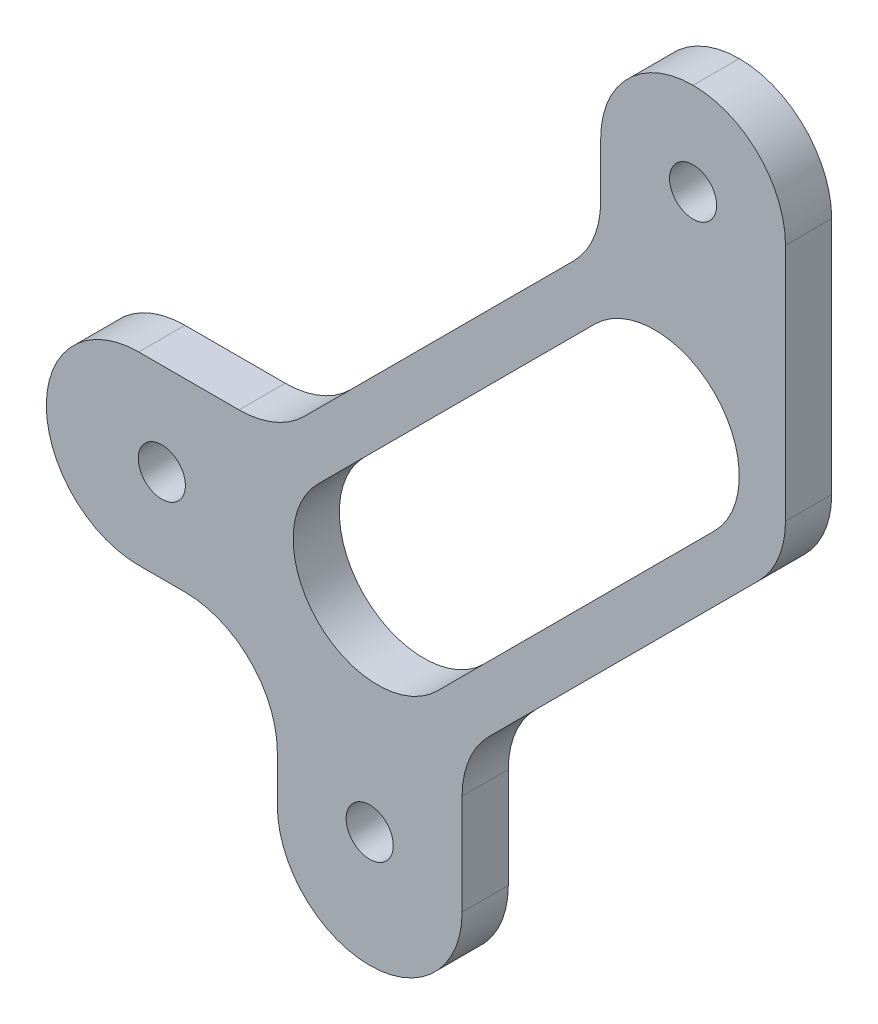
from build123d import *

# Parameters (mm, degrees)
SKETCH_1_R          = 2.55
EXTRUDE_1_DEPTH     = 5
FILLET_1_R          = 10
CUT_EXTRUDE_1_DEPTH = 94.139680051


with BuildPart() as part:
    # ｽｹｯﾁ1 → ﾎﾞｽ - 押し出し1 (new body)
    with BuildSketch(Plane.XY):
        Polygon((0, -25), (0, 0), (-25, 0), (-25, 20), (0, 20), (35, 55), (35, 75), (55, 75), (55, 35), (20, 0), (20, -25), align=None)
        with Locations((-12.5, 10)):
            Circle(SKETCH_1_R, mode=Mode.SUBTRACT)
        with Locations((10, -12.5)):
            Circle(SKETCH_1_R, mode=Mode.SUBTRACT)
        with Locations((45, 65)):
            Circle(SKETCH_1_R, mode=Mode.SUBTRACT)
    extrude(amount=EXTRUDE_1_DEPTH)

    # ﾌｨﾚｯﾄ1
    fillet_1_edges = [part.edges().sort_by_distance(p)[0] for p in [
        (35, 75, 2.5),
        (55, 75, 2.5),
        (20, 0, 2.5),
        (20, -25, 2.5),
        (0, -25, 2.5),
        (0, 0, 2.5),
        (-25, 0, 2.5),
        (-25, 20, 2.5),
        (0, 20, 2.5),
        (35, 55, 2.5),
        (55, 35, 2.5),
    ]]
    fillet(fillet_1_edges, radius=FILLET_1_R - 0.0001)  # a hair under: the kernel refuses the full size

    # ｽｹｯﾁ2 → ｶｯﾄ - 押し出し1 (cut, through all)
    with BuildSketch(Plane.XY.offset(5)):
        with BuildLine():
            Line((4.393398282, 17.32233047), (34.393398282, 47.32233047))
            ThreePointArc((34.393398282, 47.32233047), (47.32233047, 47.32233047), (47.32233047, 34.393398282))
            Line((47.32233047, 34.393398282), (17.32233047, 4.393398282))
            ThreePointArc((17.32233047, 4.393398282), (4.393398282, 4.393398282), (4.393398282, 17.32233047))
        make_face()
    extrude(amount=-CUT_EXTRUDE_1_DEPTH, mode=Mode.SUBTRACT)


solid = part.part
